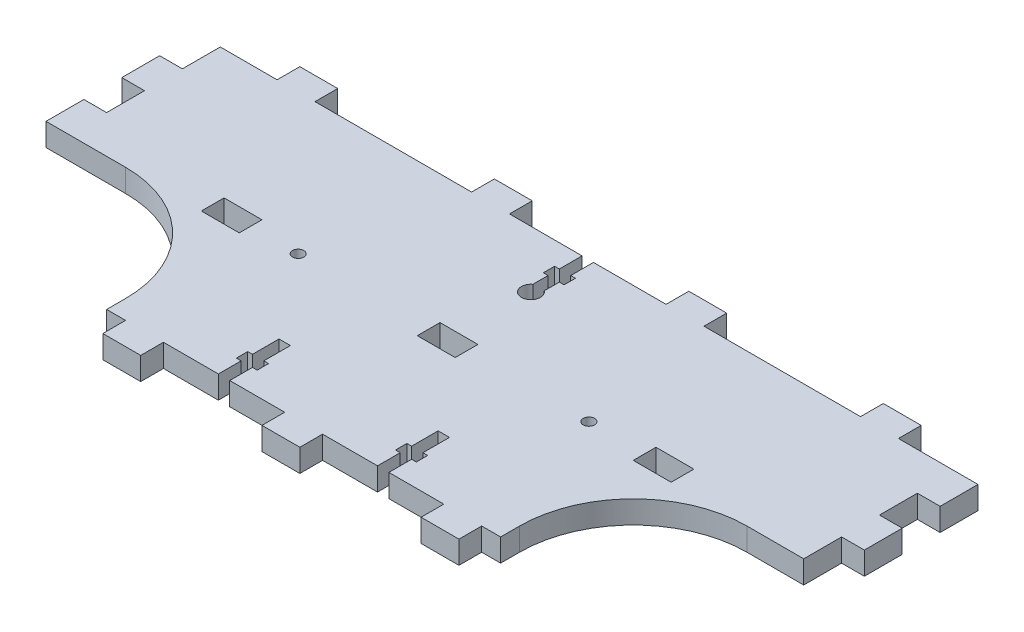
from build123d import *

# Parameters (mm, degrees)
BOSS_EXTRUDE1_DEPTH = 6
CUT_EXTRUDE2_DEPTH  = 214.684346642
SKETCH4_W           = 3
SKETCH4_H           = 16
SKETCH4_W_2         = 5.5
SKETCH4_H_2         = 3
CUT_EXTRUDE3_DEPTH  = 214.684346642
SKETCH5_W           = 10
SKETCH5_H           = 6
CUT_EXTRUDE4_DEPTH  = 214.684346642
SKETCH6_R           = 1.5
CUT_EXTRUDE5_DEPTH  = 214.684346642
SKETCH7_W           = 10
SKETCH7_H           = 6
BOSS_EXTRUDE2_DEPTH = 6
SKETCH8_R           = 2.5
CUT_EXTRUDE6_DEPTH  = 216.863382722
SKETCH9_W           = 3
SKETCH9_H           = 16
SKETCH9_W_2         = 5.5
SKETCH9_H_2         = 3
CUT_EXTRUDE7_DEPTH  = 10


with BuildPart() as part:
    # Sketch1 → Boss-Extrude1 (new body)
    with BuildSketch(Plane(origin=(0, 0, 0), x_dir=(1, 0, 0), z_dir=(0, 1, 0))):
        Polygon((-50, 0), (6, 0), (6, 35), (0, 35), (0, 45), (6, 45), (6, 55), (0, 55), (0, 65), (6, 65), (6, 75), (-194, 75), (-194, 65), (-200, 65), (-200, 55), (-194, 55), (-194, 45), (-200, 45), (-200, 35), (-194, 35), (-194, 0), (-144, 0), (-144, -6), (-134, -6), (-134, 0), (-102, 0), (-102, -6), (-92, -6), (-92, 0), (-60, 0), (-60, -6), (-50, -6), align=None)
    extrude(amount=BOSS_EXTRUDE1_DEPTH)

    # Sketch3 → Cut-Extrude2 (cut, through all)
    with BuildSketch(Plane(origin=(0, 6, 0), x_dir=(1, 0, 0), z_dir=(0, 1, 0))):
        with BuildLine():
            Line((-179, 35), (-194, 35))
            Line((-194, 35), (-194, 0))
            Line((-194, 0), (-149, 0))
            Line((-149, 0), (-149, 5))
            ThreePointArc((-149, 5), (-157.786796564, 26.213203436), (-179, 35))
        make_face()
        with BuildLine():
            Line((-45, 0), (6, 0))
            Line((6, 0), (6, 35))
            Line((6, 35), (-15, 35))
            ThreePointArc((-15, 35), (-36.213203436, 26.213203436), (-45, 5))
            Line((-45, 5), (-45, 0))
        make_face()
    extrude(amount=-CUT_EXTRUDE2_DEPTH, mode=Mode.SUBTRACT)

    # Sketch4 → Cut-Extrude3 (cut, through all)
    with BuildSketch(Plane(origin=(0, 6, 0), x_dir=(1, 0, 0), z_dir=(0, 1, 0))):
        with Locations((-118, 8)):
            Rectangle(SKETCH4_W, SKETCH4_H)
        with Locations((-76, 8)):
            Rectangle(SKETCH4_W, SKETCH4_H)
        with Locations((-118, 7.5)):
            Rectangle(SKETCH4_W_2, SKETCH4_H_2)
        with Locations((-76, 7.5)):
            Rectangle(SKETCH4_W_2, SKETCH4_H_2)
    extrude(amount=-CUT_EXTRUDE3_DEPTH, mode=Mode.SUBTRACT)

    # Sketch5 → Cut-Extrude4 (cut, through all)
    with BuildSketch(Plane.XZ):
        with Locations((-154, -38)):
            Rectangle(SKETCH5_W, SKETCH5_H)
        with Locations((-97, -38)):
            Rectangle(SKETCH5_W, SKETCH5_H)
        with Locations((-40, -38)):
            Rectangle(SKETCH5_W, SKETCH5_H)
    extrude(amount=-CUT_EXTRUDE4_DEPTH, mode=Mode.SUBTRACT)

    # Sketch6 → Cut-Extrude5 (cut, through all)
    with BuildSketch(Plane.XZ):
        with Locations((-136.443268897, -38)):
            Circle(SKETCH6_R)
        with Locations((-59.707742386, -38)):
            Circle(SKETCH6_R)
    extrude(amount=-CUT_EXTRUDE5_DEPTH, mode=Mode.SUBTRACT)

    # Sketch7 → Boss-Extrude2 (add)
    with BuildSketch(Plane(origin=(0, 6, 0), x_dir=(1, 0, 0), z_dir=(0, 1, 0))):
        with Locations((-174, 78)):
            Rectangle(SKETCH7_W, SKETCH7_H)
        with Locations((-122.666666667, 78)):
            Rectangle(SKETCH7_W, SKETCH7_H)
        with Locations((-71.333333333, 78)):
            Rectangle(SKETCH7_W, SKETCH7_H)
        with Locations((-20, 78)):
            Rectangle(SKETCH7_W, SKETCH7_H)
    extrude(amount=-BOSS_EXTRUDE2_DEPTH)

    # Sketch8 → Cut-Extrude6 (cut, through all)
    with BuildSketch(Plane.XZ):
        with Locations((-97, -60)):
            Circle(SKETCH8_R)
    extrude(amount=-CUT_EXTRUDE6_DEPTH, mode=Mode.SUBTRACT)

    # Sketch9 → Cut-Extrude7 (cut)
    with BuildSketch(Plane.XZ):
        with Locations((-97, -67)):
            Rectangle(SKETCH9_W, SKETCH9_H)
        with Locations((-97, -67.5)):
            Rectangle(SKETCH9_W_2, SKETCH9_H_2)
    extrude(amount=-CUT_EXTRUDE7_DEPTH, mode=Mode.SUBTRACT)


solid = part.part
